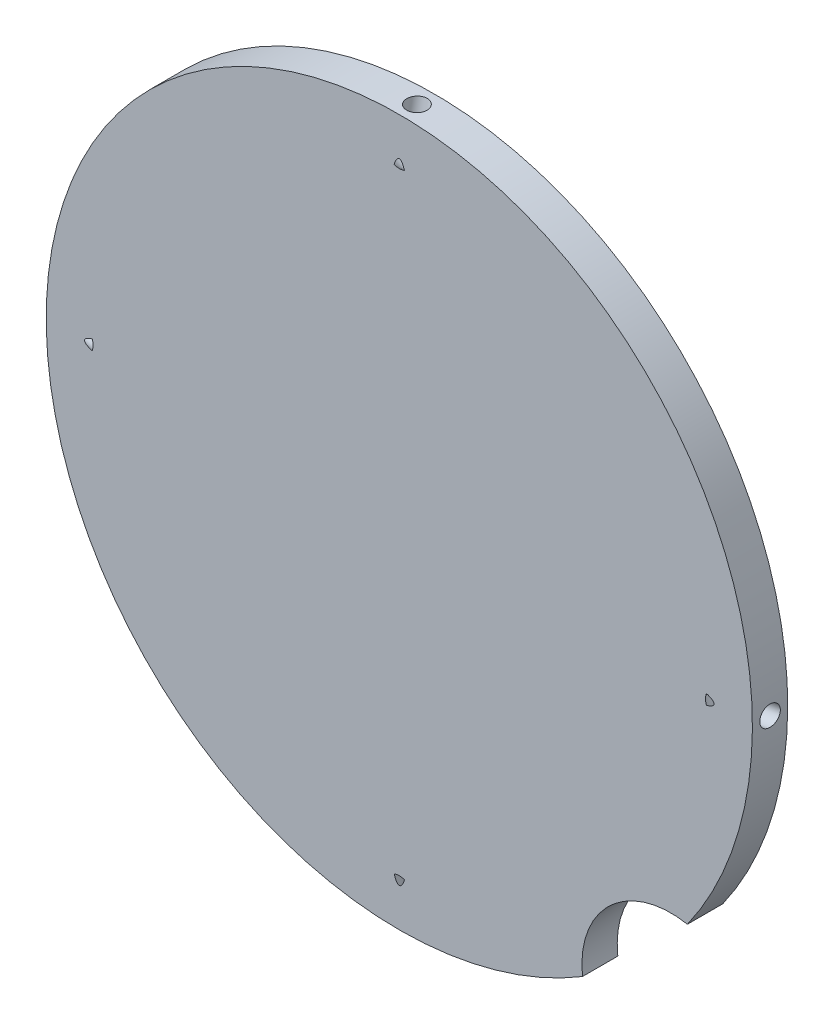
from build123d import *

# Parameters (mm, degrees)
SKETCH1_R               = 70
BOSS_EXTRUDE1_DEPTH     = 3.5
BOSS_EXTRUDE2_DEPTH     = 12
M2_5_TAPPED_HOLE1_D     = 2.05
M2_5_TAPPED_HOLE1_DEPTH = 17
CUT_EXTRUDE4_START      = -12
CUT_EXTRUDE4_DEPTH      = 12


# Read off the part's stored shape, not the designer's step: CirPattern1
with BuildPart() as part:
    # Sketch1 → Boss-Extrude1 (new, symmetric)
    with BuildSketch(Plane.XY):
        Circle(SKETCH1_R)
    extrude(amount=BOSS_EXTRUDE1_DEPTH, both=True)

    # Sketch13 → Cut-Revolve1 (revolve, cut)
    with BuildSketch(Plane(origin=(0, 0, 0), x_dir=(0, 0, -1), z_dir=(1, 0, 0))):
        Polygon((-2.040406099, -59.376585203), (0.072455051, -70.377238659), (2.036555607, -70), (0.150362311, -60.17949722), align=None)
    revolve(axis=Axis((0, -70, 0), (0, 0.982050277997827, 0.18861932956192706)), mode=Mode.SUBTRACT)

    # CirPattern1 outline → CirPattern1 (revolve, cut)
    with BuildSketch(Plane(origin=(2.490740254, 0.009350069, 12.968088503), x_dir=(0, 1, 0), z_dir=(-0.188619329561927, 0, -0.982050277997827))):
        Polygon((0, 57.935114232), (2, 59.13683547), (2, 69.127313847), (0, 69.127313847), align=None)
    revolve(axis=Axis((2.490740254, 0.009350069, 12.968088503), (0.982050277997827, 0, -0.188619329561927)), mode=Mode.SUBTRACT)

    # CirPattern1 2 outline → CirPattern1 2 (revolve, cut)
    with BuildSketch(Plane(origin=(2e-08, 2.491072904, 12.969820451), x_dir=(1, 0, 0), z_dir=(0, 0.188619329561927, 0.982050277997827))):
        Polygon((0, 57.94429647), (2, 59.146017708), (2, 69.126976101), (0, 69.126976101), align=None)
    revolve(axis=Axis((2e-08, 2.491072904, 12.969820451), (0, 0.982050277997827, -0.188619329561927)), mode=Mode.SUBTRACT)

    # CirPattern1 3 outline → CirPattern1 3 (revolve, cut)
    with BuildSketch(Plane(origin=(-2.490740254, 0.009350089, 12.9680885), x_dir=(0, 1, 0), z_dir=(0.188619329561927, 0, -0.982050277997827))):
        Polygon((2, -69.127431112), (2, -59.136835451), (0, -57.935114213), (0, -69.127431112), align=None)
    revolve(axis=Axis((-2.490740254, 0.009350089, 12.9680885), (0.982050277997827, 0, 0.188619329561927)), mode=Mode.SUBTRACT)

    # Sketch4 → Boss-Extrude2 (add)
    with BuildSketch(Plane(origin=(0, 0, -3.5), x_dir=(-1, 0, 0), z_dir=(0, 0, -1))):
        Polygon((31.875552268, 8.541028488), (48.296291314, 12.940952255), (45.708100863, 22.600210518), (40.878471732, 21.306115293), (42.690205048, 14.544634508), (31.099095132, 11.438805967), align=None)
        Polygon((56.785555994, -18.741414847), (51.955926862, -20.035510073), (50.144193547, -13.274029289), (38.553083631, -16.37985783), (37.776626496, -13.482080351), (54.197365543, -9.082156584), align=None)
    boss_extrude2 = extrude(amount=BOSS_EXTRUDE2_DEPTH)

    # M2.5 Tapped Hole1
    with Locations(Plane(origin=(-48.296291314, 12.940952255, 0), x_dir=(0, 0, 1), z_dir=(-0.9659258262890691, 0.2588190451025179, 0))):
        with Locations((-9.7, 2.35), (-9.7, -25.15)):
            m2_5_tapped_hole1 = Hole(M2_5_TAPPED_HOLE1_D / 2, depth=M2_5_TAPPED_HOLE1_DEPTH)

    # Mirror1: Boss-Extrude2, M2.5 Tapped Hole1 across plane
    add(boss_extrude2.mirror(Plane(origin=(0, 0, 0), x_dir=(0, 0, 1), z_dir=(1, 0, 0))))
    add(m2_5_tapped_hole1.mirror(Plane(origin=(0, 0, 0), x_dir=(0, 0, 1), z_dir=(1, 0, 0))), mode=Mode.SUBTRACT)

    # Sketch7 → Cut-Extrude4 (cut)
    with BuildSketch(Plane(origin=(0, 0, -3.5), x_dir=(-1, 0, 0), z_dir=(0, 0, -1)).offset(CUT_EXTRUDE4_START)):
        with BuildLine():
            ThreePointArc((-57.113972469, -40.472140403), (-41.814961007, -44.896509701), (-36.315733397, -59.842856782))
            ThreePointArc((-36.315733397, -59.842856782), (-47.708318434, -51.224177419), (-57.113972469, -40.472140403))
        make_face()
    extrude(amount=CUT_EXTRUDE4_DEPTH, mode=Mode.SUBTRACT)


solid = part.part
